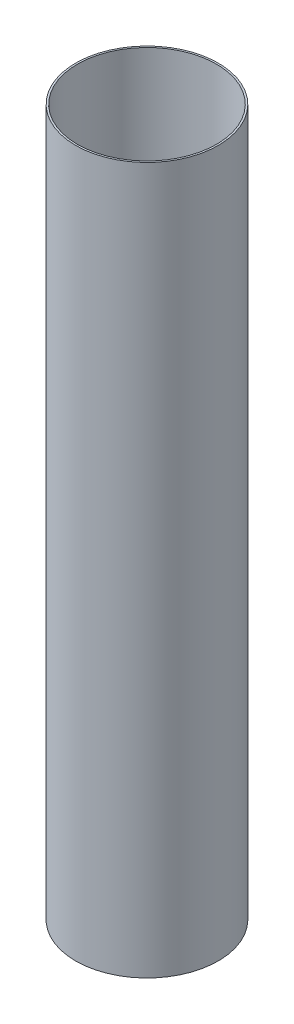
from build123d import *

# Parameters (mm, degrees)
SKETCH1_W = 1.96
SKETCH1_H = 774


with BuildPart() as part:
    # Sketch1 → Revolve1 (revolve)
    with BuildSketch(Plane.XY):
        with Locations((77.18, 387)):
            Rectangle(SKETCH1_W, SKETCH1_H)
    revolve(axis=Axis((0, 204.615384615, 0), (0, -1, 0)))


solid = part.part
